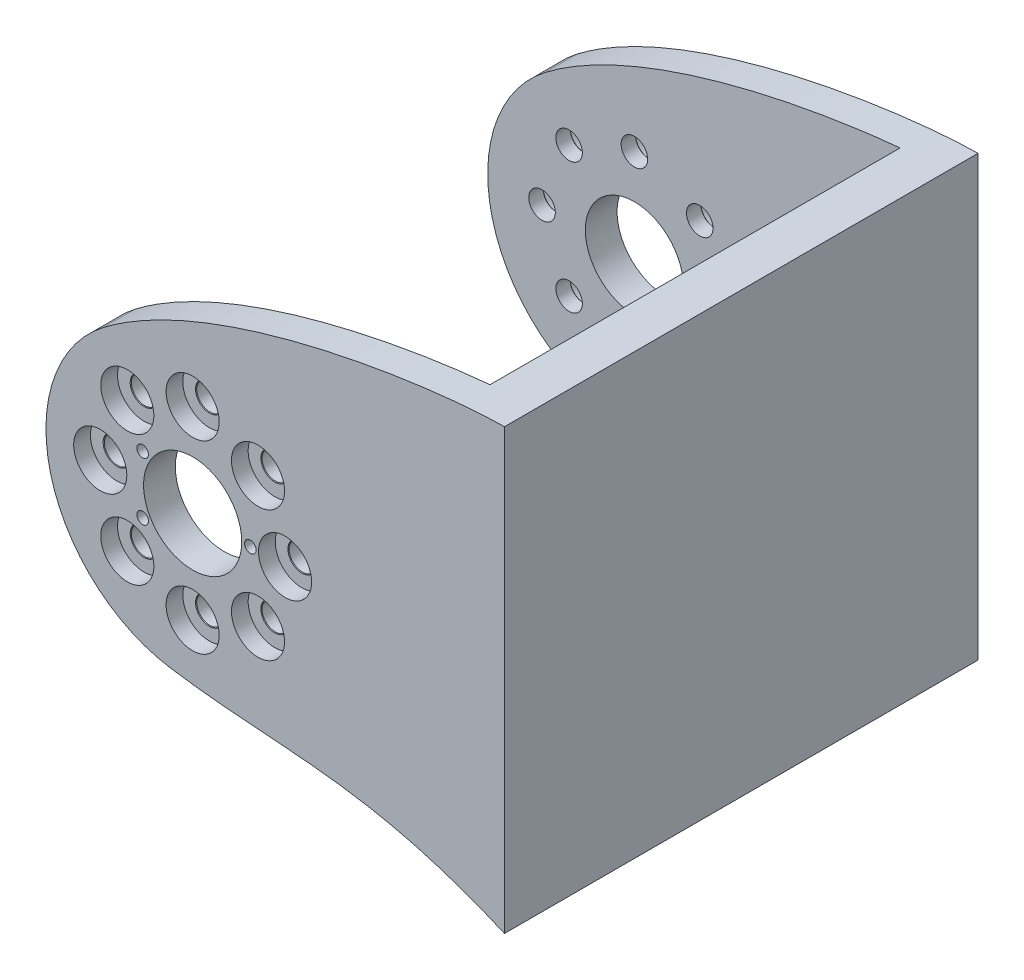
from build123d import *

# Parameters (mm, degrees)
BOSS_EXTRUDE1_DEPTH      = 20.5
SHELL1_START             = -12.7000001
SHELL1_OUTLINE_W         = 39
SHELL1_OUTLINE_H         = 35.5
SHELL1_DEPTH             = 35.7000001
SKETCH27_R               = 0.5
CUT_EXTRUDE10_DEPTH      = 1
CUT_EXTRUDE17_DEPTH      = 40.36051338
CUT_EXTRUDE17_DEPTH_BACK = 40.36051338
SKETCH35_R               = 4.25


# Read off the part's stored shape, not the designer's step: Shell1, CBORE for M2 Hex Socket Head Cap Screw2
with BuildPart() as part:
    # Sketch4 → Boss-Extrude1 (new, symmetric)
    with BuildSketch(Plane.XY):
        with BuildLine():
            Line((27, -18), (27, 20))
            add(Edge.make_bspline(
                [(-7.730668476, 10.076049072), (2.170162487, 17.672284588), (21.370784375, 20), (27, 20)],
                knots=[0, 0, 0, 0, 1, 1, 1, 1], degree=3))
            ThreePointArc((-7.730668476, 10.076049072), (-12.308703382, -3.128229699), (-1.981723336, -12.544431937))
            add(Edge.make_bspline(
                [(-1.981723336, -12.544431937), (7.580415063, -14.055023481), (14.656713895, -12.657176609), (27, -18)],
                knots=[0, 0, 0, 0, 1, 1, 1, 1], degree=3))
        make_face()
    extrude(amount=BOSS_EXTRUDE1_DEPTH, both=True)

    # Shell1 outline → Shell1 (cut)
    with BuildSketch(Plane.YZ.offset(SHELL1_START)):
        with Locations((1.5, 0)):
            Rectangle(SHELL1_OUTLINE_W, SHELL1_OUTLINE_H)
    extrude(amount=SHELL1_DEPTH, mode=Mode.SUBTRACT)

    # CBORE for M2 Hex Socket Head Cap Scr 2 → CBORE for M2 Hex Socket Head Cap Screw2 (revolve, cut)
    with BuildSketch(Plane(origin=(-5.656854249, -5.656854249, 0), x_dir=(1, 0, 0), z_dir=(0, -1, 0))):
        Polygon((0, 17.75), (1.15, 17.75), (1.15, 19), (1.2, 19.05), (2.3, 19.05), (2.3, 20.5), (0, 20.5), align=None)
    cbore_for_m2_hex_socket_head_cap_screw2 = revolve(axis=Axis((-5.656854249, -5.656854249, 0), (0, 0, 1)), mode=Mode.SUBTRACT)

    # CBORE for M2 Hex Socket Head Cap Scr 3 o → CBORE for M2 Hex Socket Head Cap Scr 3 (revolve, cut)
    with BuildSketch(Plane(origin=(-8, 0, 0), x_dir=(1, 0, 0), z_dir=(0, -1, 0))):
        Polygon((1.15, 19), (1.2, 19.05), (2.3, 19.05), (2.3, 20.5), (0, 20.5), (0, 17.75), (1.15, 17.75), align=None)
    cbore_for_m2_hex_socket_head_cap_scr_3 = revolve(axis=Axis((-8, 0, 0), (0, 0, 1)), mode=Mode.SUBTRACT)

    # CBORE for M2 Hex Socket Head Cap Scr 4 o → CBORE for M2 Hex Socket Head Cap Scr 4 (revolve, cut)
    with BuildSketch(Plane(origin=(-5.656854249, 5.656854249, 0), x_dir=(1, 0, 0), z_dir=(0, -1, 0))):
        Polygon((1.15, 19), (1.2, 19.05), (2.3, 19.05), (2.3, 20.5), (0, 20.5), (0, 17.75), (1.15, 17.75), align=None)
    cbore_for_m2_hex_socket_head_cap_scr_4 = revolve(axis=Axis((-5.656854249, 5.656854249, 0), (0, 0, 1)), mode=Mode.SUBTRACT)

    # CBORE for M2 Hex Socket Head Cap Scr 5 o → CBORE for M2 Hex Socket Head Cap Scr 5 (revolve, cut)
    with BuildSketch(Plane(origin=(8, 0, 0), x_dir=(1, 0, 0), z_dir=(0, -1, 0))):
        Polygon((1.15, 19), (1.2, 19.05), (2.3, 19.05), (2.3, 20.5), (0, 20.5), (0, 17.75), (1.15, 17.75), align=None)
    cbore_for_m2_hex_socket_head_cap_scr_5 = revolve(axis=Axis((8, 0, 0), (0, 0, 1)), mode=Mode.SUBTRACT)

    # CBORE for M2 Hex Socket Head Cap Scr 6 o → CBORE for M2 Hex Socket Head Cap Scr 6 (revolve, cut)
    with BuildSketch(Plane(origin=(5.656854249, -5.656854249, 0), x_dir=(1, 0, 0), z_dir=(0, -1, 0))):
        Polygon((1.15, 19), (1.2, 19.05), (2.3, 19.05), (2.3, 20.5), (0, 20.5), (0, 17.75), (1.15, 17.75), align=None)
    cbore_for_m2_hex_socket_head_cap_scr_6 = revolve(axis=Axis((5.656854249, -5.656854249, 0), (0, 0, 1)), mode=Mode.SUBTRACT)

    # CBORE for M2 Hex Socket Head Cap Scr 7 o → CBORE for M2 Hex Socket Head Cap Scr 7 (revolve, cut)
    with BuildSketch(Plane.XZ.offset(8)):
        Polygon((1.15, 19), (1.2, 19.05), (2.3, 19.05), (2.3, 20.5), (0, 20.5), (0, 17.75), (1.15, 17.75), align=None)
    cbore_for_m2_hex_socket_head_cap_scr_7 = revolve(axis=Axis((0, -8, 0), (0, 0, 1)), mode=Mode.SUBTRACT)

    # CBORE for M2 Hex Socket Head Cap Scr 8 o → CBORE for M2 Hex Socket Head Cap Scr 8 (revolve, cut)
    with BuildSketch(Plane.XZ.offset(-8)):
        Polygon((1.15, 19), (1.2, 19.05), (2.3, 19.05), (2.3, 20.5), (0, 20.5), (0, 17.75), (1.15, 17.75), align=None)
    cbore_for_m2_hex_socket_head_cap_scr_8 = revolve(axis=Axis((0, 8, 0), (0, 0, 1)), mode=Mode.SUBTRACT)

    # CBORE for M2 Hex Socket Head Cap Scr 9 o → CBORE for M2 Hex Socket Head Cap Scr 9 (revolve, cut)
    with BuildSketch(Plane(origin=(5.656854249, 5.656854249, 0), x_dir=(1, 0, 0), z_dir=(0, -1, 0))):
        Polygon((1.15, 19), (1.2, 19.05), (2.3, 19.05), (2.3, 20.5), (0, 20.5), (0, 17.75), (1.15, 17.75), align=None)
    cbore_for_m2_hex_socket_head_cap_scr_9 = revolve(axis=Axis((5.656854249, 5.656854249, 0), (0, 0, 1)), mode=Mode.SUBTRACT)

    # Sketch27 → Cut-Extrude10 (cut)
    with BuildSketch(Plane.XY.offset(20.5)):
        with Locations((-4.330127019, -2.5)):
            Circle(SKETCH27_R)
        with Locations((-4.330127019, 2.5)):
            Circle(SKETCH27_R)
        with Locations((5, 0)):
            Circle(SKETCH27_R)
    extrude(amount=-CUT_EXTRUDE10_DEPTH, mode=Mode.SUBTRACT)

    # Mirror2: CBORE for M2 Hex Socket Head Cap Screw2, CBORE for M2 Hex Socket Head Cap Scr 3, CBORE for M2 Hex Socket Head Cap Scr 4, CBORE for M2 Hex Socket Head Cap Scr 5, CBORE for M2 Hex Socket Head Cap Scr 6, CBORE for M2 Hex Socket Head Cap Scr 7, CBORE for M2 Hex Socket Head Cap Scr 8, CBORE for M2 Hex Socket Head Cap Scr 9 across plane
    add(cbore_for_m2_hex_socket_head_cap_screw2.mirror(Plane.XY), mode=Mode.SUBTRACT)
    add(cbore_for_m2_hex_socket_head_cap_scr_3.mirror(Plane.XY), mode=Mode.SUBTRACT)
    add(cbore_for_m2_hex_socket_head_cap_scr_4.mirror(Plane.XY), mode=Mode.SUBTRACT)
    add(cbore_for_m2_hex_socket_head_cap_scr_5.mirror(Plane.XY), mode=Mode.SUBTRACT)
    add(cbore_for_m2_hex_socket_head_cap_scr_6.mirror(Plane.XY), mode=Mode.SUBTRACT)
    add(cbore_for_m2_hex_socket_head_cap_scr_7.mirror(Plane.XY), mode=Mode.SUBTRACT)
    add(cbore_for_m2_hex_socket_head_cap_scr_8.mirror(Plane.XY), mode=Mode.SUBTRACT)
    add(cbore_for_m2_hex_socket_head_cap_scr_9.mirror(Plane.XY), mode=Mode.SUBTRACT)

    # Sketch35 → Cut-Extrude17 (cut, two sides: drawn at the far end of the back side and taken through both)
    with BuildSketch(Plane.XY.offset(-CUT_EXTRUDE17_DEPTH_BACK)):
        Circle(SKETCH35_R)
    extrude(amount=CUT_EXTRUDE17_DEPTH + CUT_EXTRUDE17_DEPTH_BACK, mode=Mode.SUBTRACT)


solid = part.part
